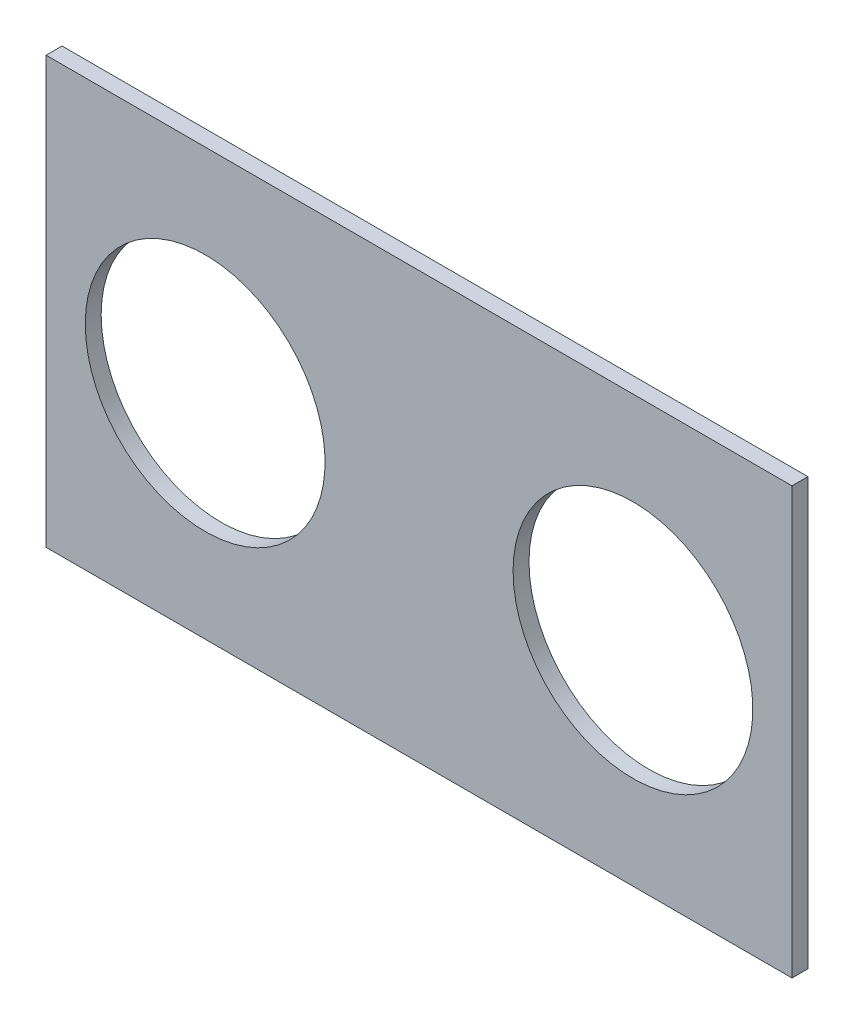
from build123d import *

# Parameters (mm, degrees)
SKETCH1_W           = 88.9
SKETCH1_H           = 50.8
SKETCH1_R           = 14.2875
BOSS_EXTRUDE1_DEPTH = 1.89738


with BuildPart() as part:
    # Sketch1 → Boss-Extrude1 (new body)
    with BuildSketch(Plane.XY):
        with Locations((25.49525, 0)):
            Rectangle(SKETCH1_W, SKETCH1_H)
        Circle(SKETCH1_R, mode=Mode.SUBTRACT)
        with Locations((50.9905, 0)):
            Circle(SKETCH1_R, mode=Mode.SUBTRACT)
    extrude(amount=BOSS_EXTRUDE1_DEPTH)


solid = part.part
